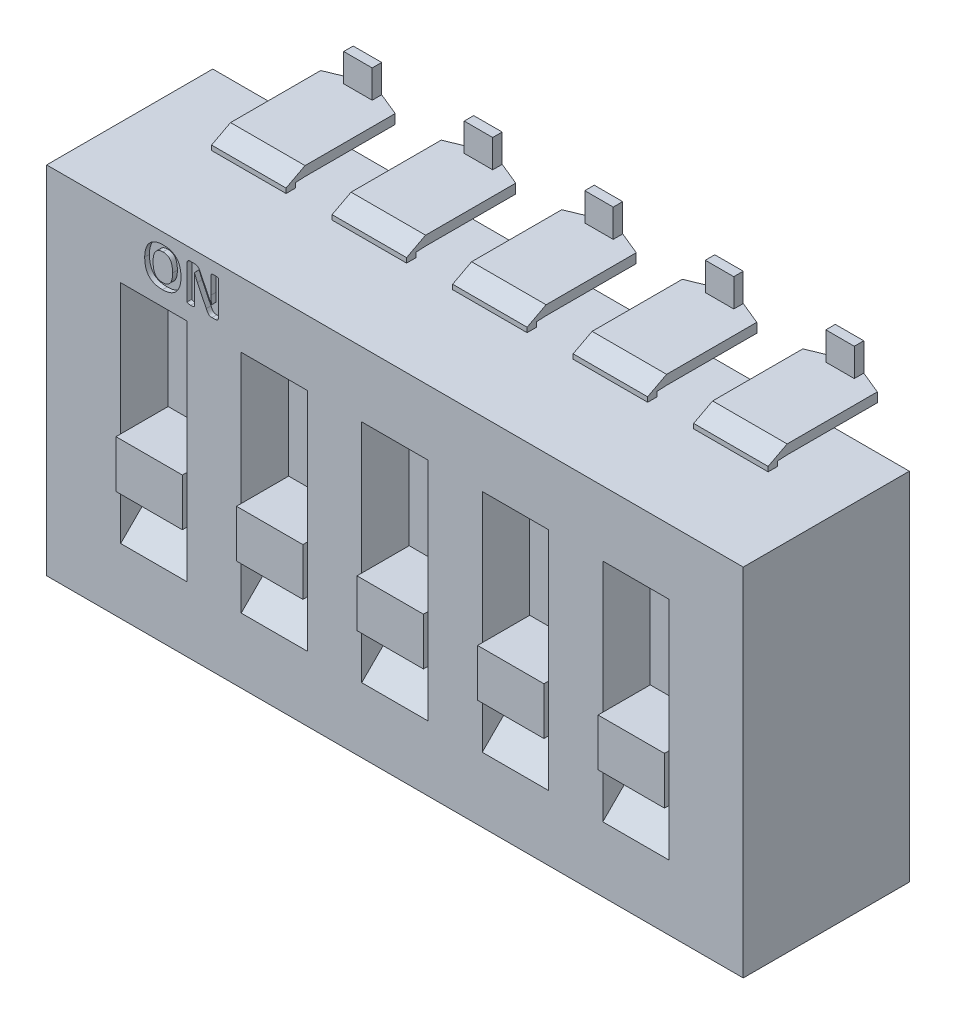
from build123d import *

# Parameters (mm, degrees)
SKETCH_1_W                         = 14.68
SKETCH_1_H                         = 7.5
EXTRUDE_1_DEPTH                    = 3.5
SKETCH_2_W                         = 1.57
SKETCH_2_H                         = 0.2
EXTRUDE_2_DEPTH                    = 0.1
SKETCH_3_W                         = 0.6
SKETCH_3_H                         = 0.79
EXTRUDE_3_DEPTH                    = 0.2
SKETCH_4_W                         = 1.57
SKETCH_4_H                         = 0.2
EXTRUDE_4_DEPTH                    = 1.9
CHAMFER_1_SIZE                     = 0.2
CHAMFER_1_SIZE_2                   = 0.485
LOFT_START                         = -5.865
LOFT_1_DEPTH                       = 1.57
SKETCH_5_W                         = 1.4
SKETCH_5_H                         = 2.76
CUT_EXTRUDE_1_DEPTH                = 1
CHAMFER_2_SIZE                     = 1
SKETCH_6_W                         = 1.4
SKETCH_6_H                         = 1
EXTRUDE_5_DEPTH                    = 1.1
PATTERN_LINEAR_3_COUNT             = 5
PATTERN_LINEAR_3_PITCH             = 2.54
CHAMFER_2_OF_PATTERN_LINEAR_3_SIZE = 1
PATTERN_LINEAR_1_COUNT             = 5
PATTERN_LINEAR_1_PITCH             = 2.54
CUT_EXTRUDE_2_DEPTH                = 0.1


# Read off the part's stored shape, not the designer's step: По сечениям1
# Some blends are built 0.0001 mm under size
with BuildPart() as part:
    # Эскиз1 → Бобышка-Вытянуть1 (new body)
    with BuildSketch(Plane.XY.offset(1)):
        Rectangle(SKETCH_1_W, SKETCH_1_H)
    extrude(amount=EXTRUDE_1_DEPTH)

    # Эскиз5 → Вырез-Вытянуть1 (cut)
    with BuildSketch(Plane.XY.offset(4.5)):
        with Locations((-5.08, 0)):
            Rectangle(SKETCH_5_W, SKETCH_5_H)
    cut_extrude_1 = extrude(amount=-CUT_EXTRUDE_1_DEPTH, mode=Mode.SUBTRACT)

    # Фаска2
    chamfer_2_edges = [part.edges().sort_by_distance(p)[0] for p in [
        (-5.08, 1.38, 4.5),
        (-5.08, -1.38, 4.5),
    ]]
    chamfer(chamfer_2_edges, length=CHAMFER_2_SIZE - 0.0001)  # a hair under: the kernel refuses the full size

    # Линейный массив3: Вырез-Вытянуть1 ×5
    with Locations(*[(i * PATTERN_LINEAR_3_PITCH, 0, 0) for i in range(1, PATTERN_LINEAR_3_COUNT)]):
        add(cut_extrude_1, mode=Mode.SUBTRACT)

    # Фаска2 of Линейный массив3
    chamfer_2_of_pattern_linear_3_edges = [part.edges().sort_by_distance(p)[0] for p in [
        (-2.54, 1.38, 4.5),
        (-2.54, -1.38, 4.5),
        (0, 1.38, 4.5),
        (0, -1.38, 4.5),
        (2.54, 1.38, 4.5),
        (2.54, -1.38, 4.5),
        (5.08, 1.38, 4.5),
        (5.08, -1.38, 4.5),
    ]]
    chamfer(chamfer_2_of_pattern_linear_3_edges, length=CHAMFER_2_OF_PATTERN_LINEAR_3_SIZE - 0.0001)  # a hair under: the kernel refuses the full size

    # Эскиз7 → Вырез-Вытянуть2 (cut)
    # profile 1 of 2: a face of its own
    with BuildSketch(Plane.XY.offset(4.5)):
        with BuildLine():
            add(Edge.make_bspline(
                [(-4.509391727, 3.114406517), (-4.509622839, 3.09833857), (-4.51007381, 3.066985037), (-4.51506288, 3.021352907), (-4.522587223, 2.97820318), (-4.533644408, 2.937811607), (-4.547521821, 2.900056251), (-4.564708226, 2.865335865), (-4.584790851, 2.833441889), (-4.608052203, 2.804631391), (-4.63433362, 2.778908939), (-4.663534795, 2.756318233), (-4.695820201, 2.737163106), (-4.730851229, 2.721121535), (-4.768808811, 2.708551981), (-4.809684942, 2.699892401), (-4.853363825, 2.694467856), (-4.883456068, 2.693795836), (-4.898913785, 2.693450635)],
                knots=[0, 0, 0, 0, 1.181067455, 2.304627813, 3.371397041, 4.398875488, 5.379772852, 6.324840374, 7.24235265, 8.145895775, 9.041233988, 9.940678369, 10.854054564, 11.795635534, 12.76881339, 13.787809768, 14.863646999, 16, 16, 16, 16], degree=3))
            add(Edge.make_bspline(
                [(-4.898913785, 2.693450635), (-4.914123191, 2.693695224), (-4.943635681, 2.694169828), (-4.986405306, 2.69890225), (-5.026251312, 2.706237255), (-5.063094954, 2.716913751), (-5.096983888, 2.730681087), (-5.127934522, 2.747734076), (-5.15613878, 2.767767928), (-5.181158165, 2.791401917), (-5.203198663, 2.818279435), (-5.222160132, 2.84855379), (-5.238433893, 2.882054508), (-5.251586167, 2.919062686), (-5.261868084, 2.959427147), (-5.268823177, 3.003304923), (-5.273344198, 3.050586252), (-5.273840894, 3.083329131), (-5.274097609, 3.100252106)],
                knots=[0, 0, 0, 0, 1.14605125, 2.223809784, 3.239278066, 4.196657126, 5.110123641, 5.990760065, 6.854667985, 7.710749604, 8.577135683, 9.46770869, 10.397275983, 11.379066547, 12.423123567, 13.532494508, 14.724683554, 16, 16, 16, 16], degree=3))
            add(Edge.make_bspline(
                [(-5.274097609, 3.100252106), (-5.27375784, 3.115948291), (-5.273094054, 3.146612985), (-5.268568599, 3.191388648), (-5.260588909, 3.233650326), (-5.24986277, 3.273503176), (-5.235902713, 3.310782702), (-5.218841717, 3.345258505), (-5.198640324, 3.376839804), (-5.175384725, 3.405446661), (-5.149164845, 3.431166247), (-5.119977857, 3.453682037), (-5.087827559, 3.472961786), (-5.052734738, 3.488936015), (-5.014691089, 3.501694575), (-4.973699991, 3.510567806), (-4.929818023, 3.515967778), (-4.899603947, 3.516635656), (-4.88402408, 3.516980047)],
                knots=[0, 0, 0, 0, 1.160914008, 2.268007866, 3.323978369, 4.338756358, 5.316875162, 6.263384146, 7.178594241, 8.083875972, 8.984426194, 9.889106488, 10.803912537, 11.750974708, 12.735550296, 13.765875032, 14.847975007, 16, 16, 16, 16], degree=3))
            add(Edge.make_bspline(
                [(-4.88402408, 3.516980047), (-4.869121351, 3.51673256), (-4.840159627, 3.516251598), (-4.7981177, 3.511537466), (-4.758808664, 3.504097585), (-4.722179526, 3.493695837), (-4.688334728, 3.480045608), (-4.657209409, 3.463389844), (-4.629153925, 3.443093784), (-4.604050056, 3.41955559), (-4.581556662, 3.392973068), (-4.562495643, 3.362836883), (-4.545962772, 3.329689538), (-4.532655302, 3.293090809), (-4.522214876, 3.253206005), (-4.514800145, 3.209974124), (-4.510108555, 3.163345896), (-4.509636022, 3.131085053), (-4.509391727, 3.114406517)],
                knots=[0, 0, 0, 0, 1.132472299, 2.200828589, 3.21116476, 4.170875335, 5.090315408, 5.980258557, 6.84769598, 7.714420291, 8.590505985, 9.487188694, 10.418317356, 11.401257481, 12.441795894, 13.548338263, 14.732515217, 16, 16, 16, 16], degree=3))
        make_face()
        with BuildLine():
            add(Edge.make_bspline(
                [(-4.685862315, 3.105582988), (-4.685949344, 3.115941269), (-4.686119428, 3.136184957), (-4.687994754, 3.165813957), (-4.691065573, 3.193981468), (-4.695474186, 3.220615703), (-4.701012401, 3.245764923), (-4.708475159, 3.269051244), (-4.717796638, 3.29043327), (-4.728544016, 3.310035588), (-4.74132552, 3.327688896), (-4.756095508, 3.343297204), (-4.773042847, 3.356539199), (-4.791745583, 3.367985536), (-4.812824745, 3.376791597), (-4.836201781, 3.383290944), (-4.862102449, 3.386833217), (-4.880153569, 3.387316837), (-4.889538785, 3.387568282)],
                knots=[0, 0, 0, 0, 1.248306964, 2.439626501, 3.576526119, 4.66195957, 5.692118455, 6.677712867, 7.603820791, 8.499754584, 9.366886977, 10.223578091, 11.080555655, 11.951954716, 12.85865995, 13.824437323, 14.868871972, 16, 16, 16, 16], degree=3))
            add(Edge.make_bspline(
                [(-4.889538785, 3.387568282), (-4.89905326, 3.387296268), (-4.917325574, 3.386773871), (-4.943587402, 3.382509678), (-4.967435375, 3.375439426), (-4.988849351, 3.365369377), (-5.007846555, 3.352903373), (-5.024987462, 3.338635407), (-5.040113589, 3.322338814), (-5.05334257, 3.304217843), (-5.064919233, 3.284449141), (-5.074044829, 3.262757103), (-5.082196974, 3.239766724), (-5.08779168, 3.21510725), (-5.092201901, 3.189446493), (-5.095219011, 3.162927318), (-5.097423215, 3.13570587), (-5.097558542, 3.117291074), (-5.097627021, 3.107972694)],
                knots=[0, 0, 0, 0, 1.153225958, 2.214741912, 3.216094119, 4.16009031, 5.073077605, 5.964494141, 6.858230186, 7.761795903, 8.68066018, 9.629003448, 10.611206296, 11.634860154, 12.690273443, 13.767663655, 14.870377893, 16, 16, 16, 16], degree=3))
            add(Edge.make_bspline(
                [(-5.097627021, 3.107972694), (-5.097537329, 3.097247364), (-5.097362416, 3.076331346), (-5.095539358, 3.045837425), (-5.092328632, 3.017029), (-5.088348101, 2.98982565), (-5.082418087, 2.964468591), (-5.075150042, 2.940836387), (-5.065922323, 2.91921986), (-5.055363544, 2.899339669), (-5.042717557, 2.881590765), (-5.028001353, 2.866095585), (-5.011149968, 2.852921711), (-4.992497553, 2.841695964), (-4.971269538, 2.833191633), (-4.947706864, 2.827295827), (-4.921642733, 2.823538907), (-4.90346197, 2.823094759), (-4.89395055, 2.8228624)],
                knots=[0, 0, 0, 0, 1.279653928, 2.495518946, 3.642823718, 4.737874749, 5.773595616, 6.747088542, 7.68406817, 8.573908718, 9.428072391, 10.276175527, 11.114292987, 11.973199623, 12.865200127, 13.831639063, 14.865603682, 16, 16, 16, 16], degree=3))
            add(Edge.make_bspline(
                [(-4.89395055, 2.8228624), (-4.884435658, 2.823131966), (-4.866162543, 2.823649662), (-4.839981775, 2.827933999), (-4.816209879, 2.834849938), (-4.794769927, 2.844652999), (-4.775829901, 2.857239099), (-4.758442564, 2.871360652), (-4.743399141, 2.887937674), (-4.730063055, 2.906232867), (-4.718685689, 2.926376658), (-4.709109202, 2.948183291), (-4.701407884, 2.971586132), (-4.695648073, 2.996474585), (-4.691283721, 3.022519238), (-4.688270181, 3.049525911), (-4.686066533, 3.07729924), (-4.685930923, 3.096080931), (-4.685862315, 3.105582988)],
                knots=[0, 0, 0, 0, 1.144095152, 2.197206425, 3.181453363, 4.114866049, 5.020624657, 5.910648687, 6.802715632, 7.705078328, 8.629453105, 9.579998293, 10.566037856, 11.588758084, 12.650348858, 13.741173613, 14.857211693, 16, 16, 16, 16], degree=3))
        make_face(mode=Mode.SUBTRACT)
    # profile 2 of 2: a face of its own
    with BuildSketch(Plane.XY.offset(4.5)):
        with BuildLine():
            add(Edge.make_bspline(
                [(-3.721156432, 2.763119753), (-3.721374728, 2.758612748), (-3.721796356, 2.749907669), (-3.725823596, 2.737842819), (-3.731743463, 2.727477818), (-3.73965669, 2.719050247), (-3.749218983, 2.712452067), (-3.760260214, 2.70817418), (-3.77204036, 2.705853795), (-3.780031853, 2.705428034), (-3.78402408, 2.705215341)],
                knots=[0, 0, 0, 0, 1.120032347, 2.163292293, 3.135130692, 4.07524891, 5.019946156, 6.00690811, 7.004331812, 8, 8, 8, 8], degree=3))
            Line((-3.78402408, 2.705215341), (-3.855347609, 2.705215341))
            add(Edge.make_bspline(
                [(-3.855347609, 2.705215341), (-3.862282127, 2.705407038), (-3.875202148, 2.705764197), (-3.893598369, 2.708908321), (-3.909860097, 2.715588557), (-3.924588191, 2.725921774), (-3.938179441, 2.740194162), (-3.951084948, 2.758752273), (-3.964112297, 2.782004329), (-3.972596888, 2.799286116), (-3.977222609, 2.808707988)],
                knots=[0, 0, 0, 0, 0.966254035, 1.800272596, 2.585200708, 3.395271146, 4.288963202, 5.317323791, 6.537429596, 8, 8, 8, 8], degree=3))
            Line((-3.977222609, 2.808707988), (-4.163803491, 3.190325635))
            add(Edge.make_bspline(
                [(-4.163803491, 3.190325635), (-4.169299131, 3.20207089), (-4.180666822, 3.226365867), (-4.1971507, 3.263738342), (-4.212687967, 3.302088435), (-4.222315977, 3.327865222), (-4.227038785, 3.340509459)],
                knots=[0, 0, 0, 0, 0.954558477, 1.974497353, 3.006434174, 4, 4, 4, 4], degree=3))
            Line((-4.227038785, 3.340509459), (-4.22832555, 3.340509459))
            add(Edge.make_bspline(
                [(-4.22832555, 3.340509459), (-4.22797875, 3.325436594), (-4.22728662, 3.295354736), (-4.226971984, 3.250068654), (-4.227056203, 3.204173708), (-4.227044652, 3.173291333), (-4.227038785, 3.157605047)],
                knots=[0, 0, 0, 0, 0.989090355, 1.973989423, 2.970915262, 4, 4, 4, 4], degree=3))
            Line((-4.227038785, 3.157605047), (-4.227038785, 2.7322374))
            add(Edge.make_bspline(
                [(-4.227038785, 2.7322374), (-4.227224359, 2.730248748), (-4.227602112, 2.726200666), (-4.230509697, 2.720473847), (-4.235753763, 2.715623762), (-4.243440576, 2.711813574), (-4.253937235, 2.709066041), (-4.267440999, 2.706614712), (-4.284684664, 2.705577797), (-4.297382257, 2.705344695), (-4.304428491, 2.705215341)],
                knots=[0, 0, 0, 0, 0.533239368, 1.085457576, 1.679302583, 2.423102222, 3.366158425, 4.586936804, 6.105999776, 8, 8, 8, 8], degree=3))
            add(Edge.make_bspline(
                [(-4.304428491, 2.705215341), (-4.311291345, 2.705341421), (-4.323805811, 2.705571328), (-4.340789889, 2.7066652), (-4.354239342, 2.708892428), (-4.364629492, 2.711521614), (-4.371958913, 2.715519421), (-4.377116018, 2.720050463), (-4.379586976, 2.725778495), (-4.379848329, 2.729707202), (-4.379979962, 2.731685929)],
                knots=[0, 0, 0, 0, 1.880338663, 3.428811631, 4.65383513, 5.615149483, 6.343797838, 6.92541045, 7.458773589, 8, 8, 8, 8], degree=3))
            Line((-4.379979962, 2.731685929), (-4.379979962, 3.447310929))
            add(Edge.make_bspline(
                [(-4.379979962, 3.447310929), (-4.37979654, 3.451868972), (-4.379448868, 3.460508657), (-4.376091252, 3.472572825), (-4.370514634, 3.482878622), (-4.362507044, 3.491005267), (-4.353158016, 3.497503095), (-4.342448391, 3.501824264), (-4.330931564, 3.504744296), (-4.322891197, 3.505055634), (-4.318766727, 3.505215341)],
                knots=[0, 0, 0, 0, 1.146599659, 2.173358234, 3.127386818, 4.066803063, 5.022080866, 5.977233821, 6.962380843, 8, 8, 8, 8], degree=3))
            Line((-4.318766727, 3.505215341), (-4.227957903, 3.505215341))
            add(Edge.make_bspline(
                [(-4.227957903, 3.505215341), (-4.220404175, 3.505121007), (-4.206565733, 3.504948187), (-4.18741683, 3.501714911), (-4.170822109, 3.49665391), (-4.156340104, 3.488222876), (-4.143118388, 3.476844051), (-4.131149481, 3.46188675), (-4.119732448, 3.443414978), (-4.11299759, 3.429550297), (-4.109391727, 3.422127106)],
                knots=[0, 0, 0, 0, 1.157819279, 2.121126641, 2.971782284, 3.805898374, 4.67303314, 5.635237899, 6.733899397, 8, 8, 8, 8], degree=3))
            Line((-4.109391727, 3.422127106), (-3.963987315, 3.131134459))
            add(Edge.make_bspline(
                [(-3.963987315, 3.131134459), (-3.959747155, 3.122378051), (-3.951362181, 3.105062133), (-3.939070249, 3.079134106), (-3.926577001, 3.053692078), (-3.914974427, 3.028156467), (-3.903533654, 3.002992379), (-3.892511118, 2.978084018), (-3.881605963, 2.953416266), (-3.874513826, 2.936961086), (-3.870972609, 2.928744753)],
                knots=[0, 0, 0, 0, 1.048159491, 2.072750013, 3.091389825, 4.101587992, 5.094292605, 6.069547355, 7.0360943, 8, 8, 8, 8], degree=3))
            add(Edge.make_bspline(
                [(-3.870972609, 2.928744753), (-3.871019642, 2.943326603), (-3.872241532, 2.973096578), (-3.873198617, 3.018080206), (-3.874033787, 3.062932861), (-3.87407669, 3.092592389), (-3.874097609, 3.107053576)],
                knots=[0, 0, 0, 0, 0.981864332, 2.004551901, 3.027073275, 4, 4, 4, 4], degree=3))
            Line((-3.874097609, 3.107053576), (-3.874097609, 3.478928576))
            add(Edge.make_bspline(
                [(-3.874097609, 3.478928576), (-3.873934264, 3.480867991), (-3.873603162, 3.484799221), (-3.870274053, 3.490266873), (-3.864761092, 3.494971952), (-3.856787957, 3.4989791), (-3.846085571, 3.502013044), (-3.832359284, 3.503816476), (-3.815177451, 3.505137797), (-3.802471447, 3.505187668), (-3.795421138, 3.505215341)],
                knots=[0, 0, 0, 0, 0.513514522, 1.040903369, 1.654763982, 2.430140109, 3.402872071, 4.610164628, 6.119047709, 8, 8, 8, 8], degree=3))
            add(Edge.make_bspline(
                [(-3.795421138, 3.505215341), (-3.788676861, 3.505186494), (-3.776398787, 3.505133979), (-3.759711134, 3.503791894), (-3.74639132, 3.502080744), (-3.736260892, 3.499045702), (-3.729075557, 3.494949704), (-3.724361447, 3.490128798), (-3.721455742, 3.484671839), (-3.721257185, 3.480739917), (-3.721156432, 3.478744753)],
                knots=[0, 0, 0, 0, 1.872486456, 3.408893843, 4.648537669, 5.595853804, 6.328496016, 6.918324485, 7.451128226, 8, 8, 8, 8], degree=3))
            Line((-3.721156432, 3.478744753), (-3.721156432, 2.763119753))
        make_face()
    extrude(amount=-CUT_EXTRUDE_2_DEPTH, mode=Mode.SUBTRACT)


with BuildPart() as body_2:
    # Эскиз2 → Бобышка-Вытянуть2 (new body)
    with BuildSketch(Plane.XZ.offset(3.75)):
        with Locations((-5.08, 2.4)):
            Rectangle(SKETCH_2_W, SKETCH_2_H)
    extrude(amount=EXTRUDE_2_DEPTH)



with BuildPart() as body_3:
    # Эскиз3 → Бобышка-Вытянуть3 (new body)
    with BuildSketch(Plane.XY):
        with Locations((-5.08, -4.255)):
            Rectangle(SKETCH_3_W, SKETCH_3_H)
    extrude(amount=EXTRUDE_3_DEPTH)

    # Эскиз4 → Бобышка-Вытянуть4 (add)
    with BuildSketch(Plane.XY.offset(0.2)):
        with Locations((-5.08, -3.96)):
            Rectangle(SKETCH_4_W, SKETCH_4_H)
    extrude(amount=EXTRUDE_4_DEPTH)

    # Фаска1
    # the kernel refuses this chamfer: 0.485, 0.2 mm, written as the material it adds along each edge
    with BuildSketch(Plane(origin=(-4.78, -3.86, 0.2), x_dir=(-0.08615522911587978, 0, -0.9962817254652372), z_dir=(0, -1, 0)), Plane(origin=(-5.38, -4.06, 0.2), x_dir=(0.08615522911587978, 0, -0.9962817254652372), z_dir=(0, 1, 0))) as chamfer_1_piece_1:
        Polygon((CHAMFER_1_SIZE * 0.996281725465, CHAMFER_1_SIZE * 0.0861552291159), (-CHAMFER_1_SIZE_2 * 0.0861552291159, CHAMFER_1_SIZE_2 * 0.996281725465), (0, 0), align=None)
    extrude(amount=0.2)


with BuildPart() as body_2_1:
    add(body_2.part)

    add(body_3.part)  # По сечениям1 merges body 3
    # По сечениям1 outline → По сечениям1 (add)
    with BuildSketch(Plane.YZ.offset(LOFT_START)):
        Polygon((-3.85, 2.3), (-3.85, 2.5), (-4.06, 2.1), (-3.86, 2.1), align=None)
    extrude(amount=LOFT_1_DEPTH)


with BuildPart() as body_3_2:
    # Эскиз6 → Бобышка-Вытянуть5 (new body)
    with BuildSketch(Plane.XY.offset(3.5)):
        with Locations((-5.08, -0.88)):
            Rectangle(SKETCH_6_W, SKETCH_6_H)
    extrude(amount=EXTRUDE_5_DEPTH)


with BuildPart() as body_4:
    # Зеркальное отражение1: mirrored copy
    add(body_2_1.part.mirror(Plane.ZX))


with BuildPart() as pattern_linear_1_1:
    # Линейный массив1: pattern copy
    add(body_4.part.moved(Location(Vector(1, 0, 0) * (1 * PATTERN_LINEAR_1_PITCH))))


with BuildPart() as pattern_linear_1_2:
    # Линейный массив1: pattern copy
    add(body_4.part.moved(Location(Vector(1, 0, 0) * (2 * PATTERN_LINEAR_1_PITCH))))


with BuildPart() as pattern_linear_1_3:
    # Линейный массив1: pattern copy
    add(body_4.part.moved(Location(Vector(1, 0, 0) * (3 * PATTERN_LINEAR_1_PITCH))))


with BuildPart() as pattern_linear_1_4:
    # Линейный массив1: pattern copy
    add(body_4.part.moved(Location(Vector(1, 0, 0) * (4 * PATTERN_LINEAR_1_PITCH))))


with BuildPart() as pattern_linear_1_5:
    # Линейный массив1: pattern copy
    add(body_2_1.part.moved(Location(Vector(1, 0, 0) * (1 * PATTERN_LINEAR_1_PITCH))))


with BuildPart() as pattern_linear_1_6:
    # Линейный массив1: pattern copy
    add(body_2_1.part.moved(Location(Vector(1, 0, 0) * (2 * PATTERN_LINEAR_1_PITCH))))


with BuildPart() as pattern_linear_1_7:
    # Линейный массив1: pattern copy
    add(body_2_1.part.moved(Location(Vector(1, 0, 0) * (3 * PATTERN_LINEAR_1_PITCH))))


with BuildPart() as pattern_linear_1_8:
    # Линейный массив1: pattern copy
    add(body_2_1.part.moved(Location(Vector(1, 0, 0) * (4 * PATTERN_LINEAR_1_PITCH))))


with BuildPart() as pattern_linear_1_9:
    # Линейный массив1: pattern copy
    add(body_3_2.part.moved(Location(Vector(1, 0, 0) * (1 * PATTERN_LINEAR_1_PITCH))))


with BuildPart() as pattern_linear_1_10:
    # Линейный массив1: pattern copy
    add(body_3_2.part.moved(Location(Vector(1, 0, 0) * (2 * PATTERN_LINEAR_1_PITCH))))


with BuildPart() as pattern_linear_1_11:
    # Линейный массив1: pattern copy
    add(body_3_2.part.moved(Location(Vector(1, 0, 0) * (3 * PATTERN_LINEAR_1_PITCH))))


with BuildPart() as pattern_linear_1_12:
    # Линейный массив1: pattern copy
    add(body_3_2.part.moved(Location(Vector(1, 0, 0) * (4 * PATTERN_LINEAR_1_PITCH))))


solid = Compound([part.part, body_2_1.part, body_3_2.part, body_4.part, pattern_linear_1_1.part, pattern_linear_1_2.part, pattern_linear_1_3.part, pattern_linear_1_4.part, pattern_linear_1_5.part, pattern_linear_1_6.part, pattern_linear_1_7.part, pattern_linear_1_8.part, pattern_linear_1_9.part, pattern_linear_1_10.part, pattern_linear_1_11.part, pattern_linear_1_12.part])
